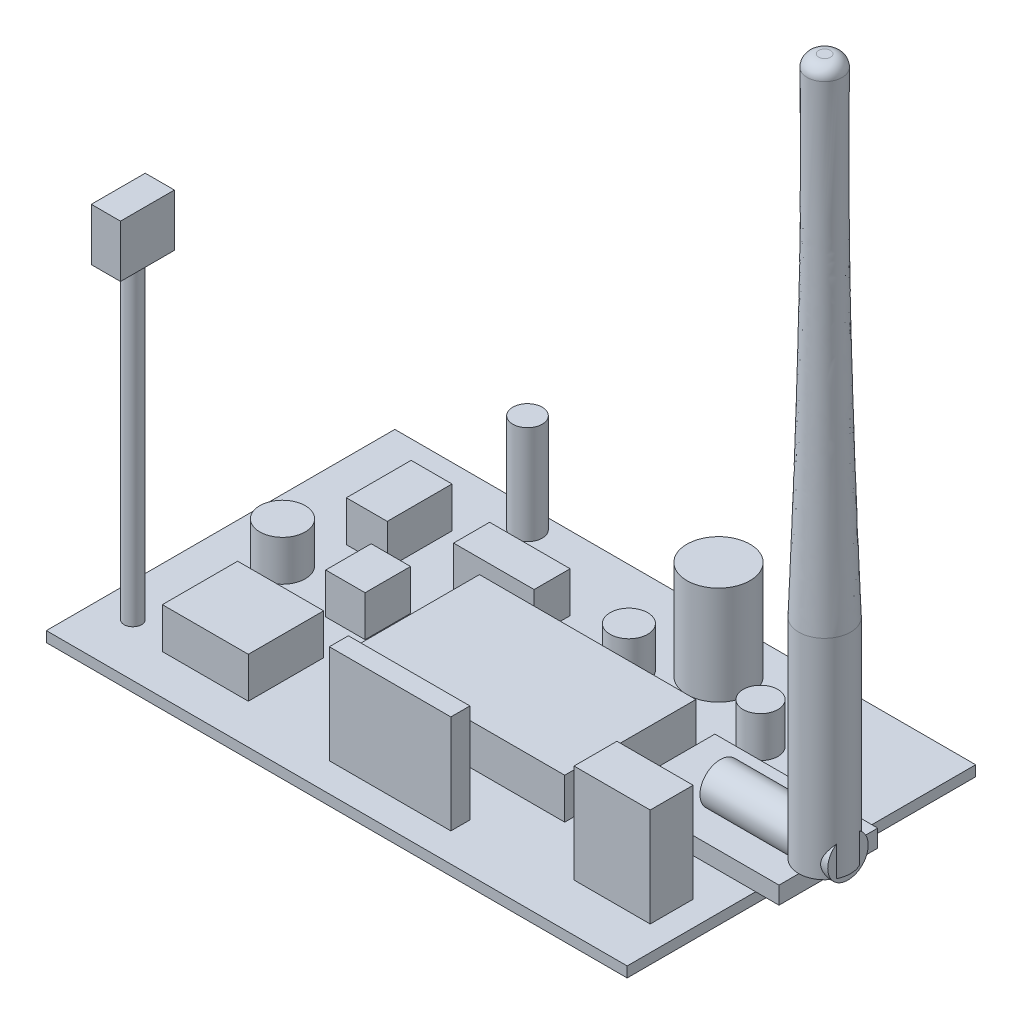
from build123d import *

# Parameters (mm, degrees)
SKETCH_1_W           = 100
SKETCH_1_H           = 60
EXTRUDE_1_DEPTH      = 1.8
SKETCH_2_W           = 28.035932228
SKETCH_2_H           = 17
EXTRUDE_2_DEPTH      = 3
SKETCH_3_R           = 4.4660261
EXTRUDE_3_DEPTH      = 36
FILLET_1_R           = 2
EXTRUDE_4_DEPTH      = 4
EXTRUDE_4_DEPTH_BACK = 18
SKETCH_5_R           = 3.485899794
SKETCH_6_R           = 1.5
EXTRUDE_5_DEPTH      = 54
SKETCH_7_W           = 5.022784178
SKETCH_7_H           = 9.283620646
EXTRUDE_6_DEPTH      = 9
SKETCH_8_R           = 2.995676271
SKETCH_8_R_2         = 3.913381196
SKETCH_8_R_3         = 3.23055129
SKETCH_8_W           = 14.80227989
SKETCH_8_H           = 12.960220437
SKETCH_8_W_2         = 37.251391954
SKETCH_8_H_2         = 22.572187892
SKETCH_8_W_3         = 7.03946311
SKETCH_8_H_3         = 11.152107008
SKETCH_8_W_4         = 13.860680023
SKETCH_8_H_4         = 6.200099882
SKETCH_8_W_5         = 6.780047866
SKETCH_8_H_5         = 7.826762392
EXTRUDE_7_DEPTH      = 7
SKETCH_9_R           = 5.435360368
SKETCH_9_R_2         = 2.536600753
SKETCH_9_W           = 13.115606058
SKETCH_9_H           = 7.387065748
SKETCH_9_W_2         = 20.924425377
SKETCH_9_H_2         = 3.280564091
EXTRUDE_8_DEPTH      = 17


with BuildPart() as part:
    # 草图1 → 凸台-拉伸1 (new body)
    with BuildSketch(Plane(origin=(0, 0, 0), x_dir=(1, 0, 0), z_dir=(0, 1, 0))):
        Rectangle(SKETCH_1_W, SKETCH_1_H)
    extrude(amount=EXTRUDE_1_DEPTH)

    # 草图2 → 凸台-拉伸2 (add)
    with BuildSketch(Plane(origin=(0, 1.8, 0), x_dir=(1, 0, 0), z_dir=(0, 1, 0))):
        with Locations((40, 0.62339544)):
            Rectangle(SKETCH_2_W, SKETCH_2_H)
    extrude(amount=EXTRUDE_2_DEPTH)

    # 草图3 → 凸台-拉伸3 (add)
    with BuildSketch(Plane(origin=(0, 4.8, 0), x_dir=(1, 0, 0), z_dir=(0, 1, 0))):
        with Locations(Location((54, 0, 0), (0, 0, 89.769507549))):
            Circle(SKETCH_3_R)
    extrude(amount=EXTRUDE_3_DEPTH)

    # 放样1: read off the stored shape, not the designer's step
    # 放样1: loft between two sections, ruled curve by curve
    loft_1_from = [
        Edge.make_bspline([(57.589860253, 40.8, 2.656744716), (62.903349686, 40.8, -4.52297579), (55.72362918, 40.8, -9.836465222), (50.410139747, 40.8, -2.656744716), (45.096650314, 40.8, 4.52297579), (52.27637082, 40.8, 9.836465222), (57.589860253, 40.8, 2.656744716)], [0, 0, 0, 0, 0.5, 0.5, 0.5, 1, 1, 1, 1], 3, [1, 0.333333333, 0.333333333, 1, 0.333333333, 0.333333333, 1]),
    ]
    loft_1_to = [
        Edge.make_bspline([(56.743086688, 124.8, -1.30542509), (54.132236508, 124.8, -6.791598467), (48.646063131, 124.8, -4.180748287), (51.256913312, 124.8, 1.30542509), (53.867763492, 124.8, 6.791598467), (59.353936869, 124.8, 4.180748287), (56.743086688, 124.8, -1.30542509)], [0, 0, 0, 0, 0.5, 0.5, 0.5, 1, 1, 1, 1], 3, [1, 0.333333333, 0.333333333, 1, 0.333333333, 0.333333333, 1]),
    ]
    loft_1 = Solid(Shell([*[Face.make_surface_from_curves(loft_1_from[k], loft_1_to[k]) for k in range(1)], Face(Wire(loft_1_from)), Face(Wire(loft_1_to))]))
    add(loft_1)

    # 圆角1
    fillet_1_edges = [part.edges().sort_by_distance(p)[0] for p in [
        (51.256913312, 124.8, 1.30542509),
    ]]
    fillet(fillet_1_edges, radius=FILLET_1_R)

    # 草图5 → 凸台-拉伸4 (add, two sides: drawn at the far end of the back side and taken through both)
    with BuildSketch(Plane(origin=(54.017966114, 0, 0), x_dir=(0, 0, -1), z_dir=(1, 0, 0)).offset(-EXTRUDE_4_DEPTH_BACK)):
        with Locations((0, 7.091500567)):
            Circle(SKETCH_5_R)
    extrude(amount=EXTRUDE_4_DEPTH + EXTRUDE_4_DEPTH_BACK)

    # 草图6 → 凸台-拉伸5 (add)
    with BuildSketch(Plane(origin=(0, 1.8, 0), x_dir=(1, 0, 0), z_dir=(0, 1, 0))):
        with Locations(Location((-44.176840226, -20.926898996, 0), (0, 0, 270))):
            Circle(SKETCH_6_R)
    extrude(amount=EXTRUDE_5_DEPTH)

    # 草图7 → 凸台-拉伸6 (add)
    with BuildSketch(Plane(origin=(0, 55.8, 0), x_dir=(1, 0, 0), z_dir=(0, 1, 0))):
        with Locations((-44.176840226, -20.926898996)):
            Rectangle(SKETCH_7_W, SKETCH_7_H)
    extrude(amount=EXTRUDE_6_DEPTH)

    # 草图8 → 凸台-拉伸7 (add)
    with BuildSketch(Plane(origin=(0, 1.8, 0), x_dir=(1, 0, 0), z_dir=(0, 1, 0))):
        with Locations(Location((28.750153934, 14.209939116, 0), (0, 0, 270))):
            Circle(SKETCH_8_R)
        with Locations(Location((-39.338854446, 0, 0), (0, 0, 270))):
            Circle(SKETCH_8_R_2)
        with Locations(Location((6.087776547, 14.209939116, 0), (0, 0, 270))):
            Circle(SKETCH_8_R_3)
        with Locations((-29.478201176, -16.663954757)):
            Rectangle(SKETCH_8_W, SKETCH_8_H)
        with Locations((4.562248459, -2.652208334)):
            Rectangle(SKETCH_8_W_2, SKETCH_8_H_2)
        with Locations((-33.458891008, 14.209939116)):
            Rectangle(SKETCH_8_W_3, SKETCH_8_H_3)
        with Locations((-14.063447519, 14.209939116)):
            Rectangle(SKETCH_8_W_4, SKETCH_8_H_4)
        with Locations((-24.597460964, 0)):
            Rectangle(SKETCH_8_W_5, SKETCH_8_H_5)
    extrude(amount=EXTRUDE_7_DEPTH)

    # 草图9 → 凸台-拉伸8 (add)
    with BuildSketch(Plane(origin=(0, 1.8, 0), x_dir=(1, 0, 0), z_dir=(0, 1, 0))):
        with Locations(Location((14.694438418, 21.029865225, 0), (0, 0, 270))):
            Circle(SKETCH_9_R)
        with Locations(Location((-23.624550245, 26.465225593, 0), (0, 0, 270))):
            Circle(SKETCH_9_R_2)
        with Locations((39.178063873, -18.07482194)):
            Rectangle(SKETCH_9_W, SKETCH_9_H)
        with Locations((4.232225729, -23.408636859)):
            Rectangle(SKETCH_9_W_2, SKETCH_9_H_2)
    extrude(amount=EXTRUDE_8_DEPTH)


solid = part.part
